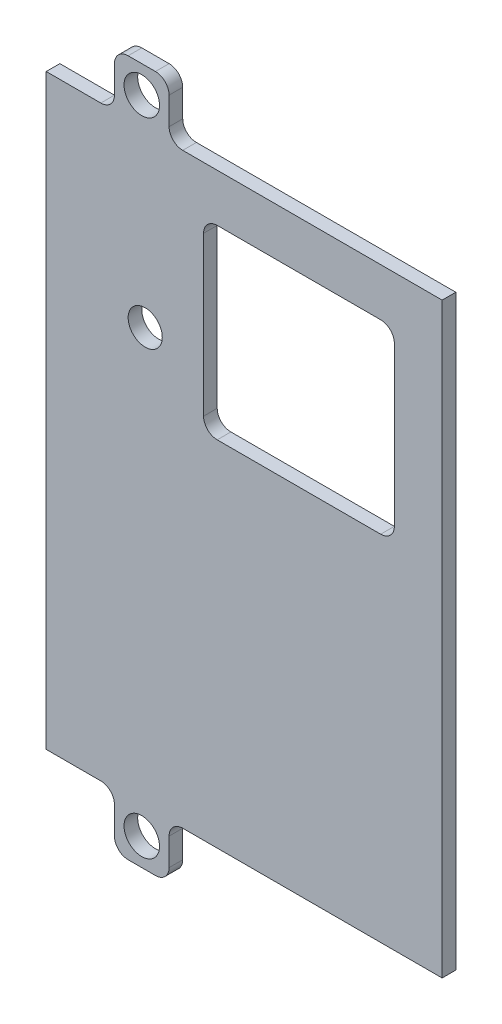
from build123d import *

# Parameters (mm, degrees)
SKETCH1_R           = 3.302
SKETCH1_R_2         = 3.175
SKETCH1_W           = 35.4965
SKETCH1_H           = 34.54456272
BOSS_EXTRUDE1_DEPTH = 2.54
SKETCH3_W           = 9.144
SKETCH3_H           = 3.81
BOSS_EXTRUDE2_DEPTH = 8.89
FILLET1_R           = 2.54


with BuildPart() as part:
    # Sketch1 → Boss-Extrude1 (new body)
    with BuildSketch(Plane.XY):
        with BuildLine():
            Line((19.05, 107.95), (19.05, 113.03))
            ThreePointArc((19.05, 113.03), (18.306051224, 114.826051224), (16.51, 115.57))
            Line((16.51, 115.57), (11.43, 115.57))
            ThreePointArc((11.43, 115.57), (9.633948776, 114.826051224), (8.89, 113.03))
            Line((8.89, 113.03), (8.89, 107.95))
            ThreePointArc((8.89, 107.95), (8.146051224, 106.153948776), (6.35, 105.41))
            Line((6.35, 105.41), (-3.81, 105.41))
            Line((-3.81, 105.41), (-3.81, -3.81))
            Line((-3.81, -3.81), (6.35, -3.81))
            ThreePointArc((6.35, -3.81), (8.146051224, -4.553948776), (8.89, -6.35))
            Line((8.89, -6.35), (8.89, -11.43))
            ThreePointArc((8.89, -11.43), (9.633948776, -13.226051224), (11.43, -13.97))
            Line((11.43, -13.97), (16.51, -13.97))
            ThreePointArc((16.51, -13.97), (18.306051224, -13.226051224), (19.05, -11.43))
            Line((19.05, -11.43), (19.05, -6.35))
            ThreePointArc((19.05, -6.35), (19.793948776, -4.553948776), (21.59, -3.81))
            Line((21.59, -3.81), (69.85, -3.81))
            Line((69.85, -3.81), (69.85, 105.41))
            Line((69.85, 105.41), (21.59, 105.41))
            ThreePointArc((21.59, 105.41), (19.793948776, 106.153948776), (19.05, 107.95))
        make_face()
        with Locations((13.97, -8.89)):
            Circle(SKETCH1_R, mode=Mode.SUBTRACT)
        with Locations((14.607116803, 73.380830868)):
            Circle(SKETCH1_R_2, mode=Mode.SUBTRACT)
        with Locations((13.97, 110.49)):
            Circle(SKETCH1_R, mode=Mode.SUBTRACT)
        with Locations((43.21175, 79.24771864)):
            Rectangle(SKETCH1_W, SKETCH1_H, mode=Mode.SUBTRACT)
    extrude(amount=BOSS_EXTRUDE1_DEPTH)

    # Sketch3 → Boss-Extrude2 (add)
    with BuildSketch(Plane(origin=(0, 0, 0), x_dir=(-1, 0, 0), z_dir=(0, 0, -1))):
        with Locations((-42.418, -1.905)):
            Rectangle(SKETCH3_W, SKETCH3_H)
    extrude(amount=BOSS_EXTRUDE2_DEPTH)

    # Fillet1
    fillet1_edges = [part.edges().sort_by_distance(p)[0] for p in [
        (60.96, 61.97543728, 1.27),
        (60.96, 96.52, 1.27),
        (25.4635, 96.52, 1.27),
        (25.4635, 61.97543728, 1.27),
    ]]
    fillet(fillet1_edges, radius=FILLET1_R)


solid = part.part
